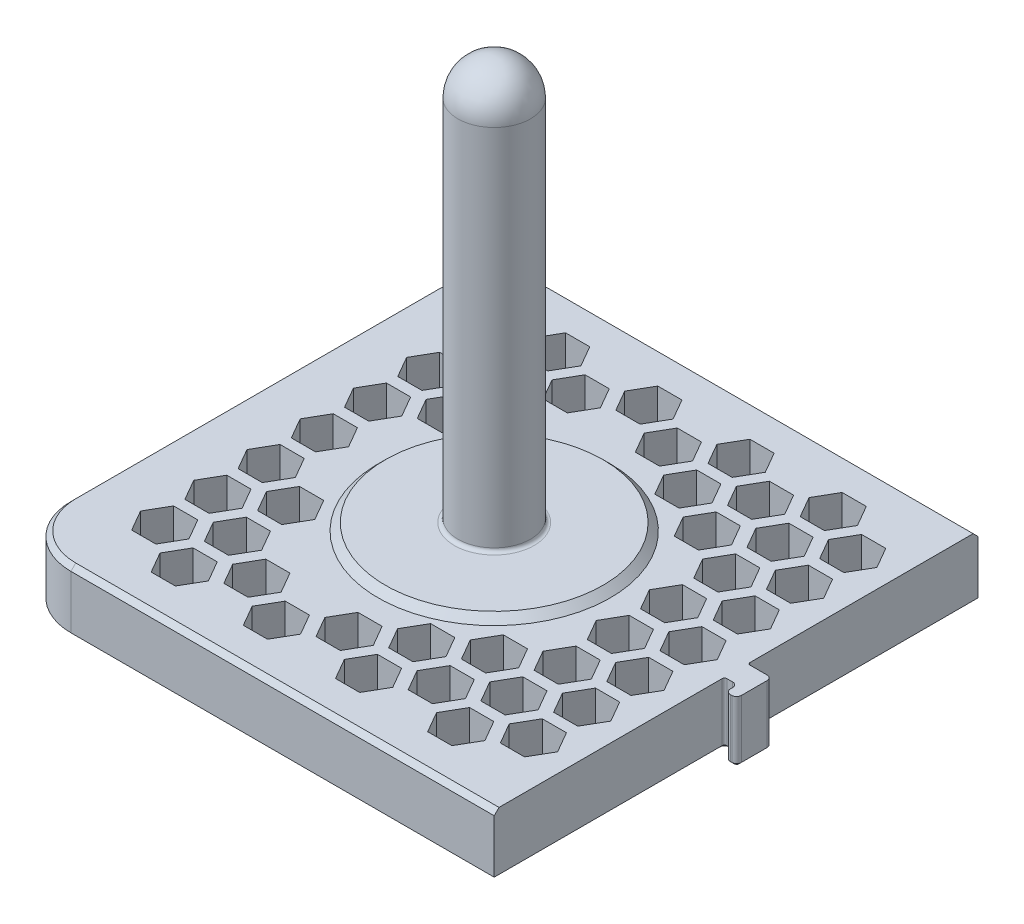
from build123d import *

# Parameters (mm, degrees)
SKETCH1_W           = 200
SKETCH1_H           = 200
BOSS_EXTRUDE1_DEPTH = 25
SKETCH2_R           = 15
BOSS_EXTRUDE2_DEPTH = 170
BOSS_EXTRUDE3_DEPTH = 25
FILLET1_R           = 1
FILLET2_R           = 25
FILLET3_R           = 15
SKETCH5_R           = 45
BOSS_EXTRUDE4_DEPTH = 3
CHAMFER1_SIZE       = 3
FILLET4_R           = 1.5
CHAMFER2_SIZE       = 2
FILL_PATTERN1_DEPTH = 25
CHAMFER3_SIZE       = 1


# Read off the part's stored shape, not the designer's step: Fill Pattern1
with BuildPart() as part:
    # Sketch1 → Boss-Extrude1 (new body)
    with BuildSketch(Plane(origin=(0, 0, 0), x_dir=(1, 0, 0), z_dir=(0, 1, 0))):
        Rectangle(SKETCH1_W, SKETCH1_H)
    extrude(amount=BOSS_EXTRUDE1_DEPTH)

    # Sketch2 → Boss-Extrude2 (add)
    with BuildSketch(Plane(origin=(0, 25, 0), x_dir=(1, 0, 0), z_dir=(0, 1, 0))):
        with Locations(Location((0, 0, 0), (0, 0, 270))):
            Circle(SKETCH2_R)
    extrude(amount=BOSS_EXTRUDE2_DEPTH)

    # Sketch4 → Boss-Extrude3 (add)
    with BuildSketch(Plane(origin=(0, 0, 0), x_dir=(1, 0, 0), z_dir=(0, 1, 0))):
        with BuildLine():
            Line((100, 4.8), (108, 4.8))
            ThreePointArc((108, 4.8), (109.414213562, 4.214213562), (110, 2.8))
            Line((110, 2.8), (110, -7.8))
            ThreePointArc((110, -7.8), (109.414213562, -9.214213562), (108, -9.8))
            Line((108, -9.8), (107.4, -9.8))
            ThreePointArc((107.4, -9.8), (105.985786438, -9.214213562), (105.4, -7.8))
            Line((105.4, -7.8), (105.4, -6.8))
            ThreePointArc((105.4, -6.8), (104.814213562, -5.385786438), (103.4, -4.8))
            Line((103.4, -4.8), (100, -4.8))
            Line((100, -4.8), (100, 4.8))
        make_face()
    extrude(amount=BOSS_EXTRUDE3_DEPTH)

    # Fillet1
    fillet1_edges = [part.edges().sort_by_distance(p)[0] for p in [
        (100, 12.5, -4.8),
        (100, 12.5, 4.8),
    ]]
    fillet(fillet1_edges, radius=FILLET1_R)

    # Fillet2
    fillet2_edges = [part.edges().sort_by_distance(p)[0] for p in [
        (-100, 12.5, -100),
        (-100, 12.5, 100),
    ]]
    fillet(fillet2_edges, radius=FILLET2_R)

    # Fillet3
    fillet3_edges = [part.edges().sort_by_distance(p)[0] for p in [
        (0, 195, -15),
    ]]
    fillet(fillet3_edges, radius=FILLET3_R)

    # Sketch5 → Boss-Extrude4 (add)
    with BuildSketch(Plane(origin=(0, 25, 0), x_dir=(1, 0, 0), z_dir=(0, 1, 0))):
        with Locations(Location((0, 0, 0), (0, 0, 270))):
            Circle(SKETCH5_R)
    extrude(amount=BOSS_EXTRUDE4_DEPTH)

    # Chamfer1
    chamfer1_edges = [part.edges().sort_by_distance(p)[0] for p in [
        (0, 25, -45),
    ]]
    chamfer(chamfer1_edges, length=CHAMFER1_SIZE - 0.0001)  # a hair under: the kernel refuses the full size

    # Fillet4
    fillet4_edges = [part.edges().sort_by_distance(p)[0] for p in [
        (0, 28, -15),
    ]]
    fillet(fillet4_edges, radius=FILLET4_R)

    # Chamfer2
    chamfer2_edges = [part.edges().sort_by_distance(p)[0] for p in [
        (12.5, 25, -100),
        (-100, 25, 0),
        (12.5, 25, 100),
        (-92.67766953, 25, 92.67766953),
        (-92.67766953, 25, -92.67766953),
    ]]
    chamfer(chamfer2_edges, length=CHAMFER2_SIZE)

    # Fill Pattern1 outline → Fill Pattern1 (cut)
    with BuildSketch(Plane(origin=(0, 0, 0), x_dir=(1, 0, 0), z_dir=(0, 1, 0))):
        Polygon((-61.15767665, 77), (-56.15767665, 68.339745962), (-46.15767665, 68.339745962), (-41.15767665, 77), (-46.15767665, 85.660254038), (-56.15767665, 85.660254038), align=None)
        Polygon((15.052558883, -55), (20.052558883, -63.660254038), (30.052558883, -63.660254038), (35.052558883, -55), (30.052558883, -46.339745962), (20.052558883, -46.339745962), align=None)
        Polygon((58.15767665, 68.339745962), (68.15767665, 68.339745962), (73.15767665, 77), (68.15767665, 85.660254038), (58.15767665, 85.660254038), (53.15767665, 77), align=None)
        Polygon((20.052558883, 68.339745962), (30.052558883, 68.339745962), (35.052558883, 77), (30.052558883, 85.660254038), (20.052558883, 85.660254038), (15.052558883, 77), align=None)
        Polygon((-18.052558883, 68.339745962), (-8.052558883, 68.339745962), (-3.052558883, 77), (-8.052558883, 85.660254038), (-18.052558883, 85.660254038), (-23.052558883, 77), align=None)
        Polygon((-65.210235533, 35.339745962), (-60.210235533, 44), (-65.210235533, 52.660254038), (-75.210235533, 52.660254038), (-80.210235533, 44), (-75.210235533, 35.339745962), align=None)
        Polygon((-61.15767665, -77), (-56.15767665, -85.660254038), (-46.15767665, -85.660254038), (-41.15767665, -77), (-46.15767665, -68.339745962), (-56.15767665, -68.339745962), align=None)
        Polygon((-80.210235533, -44), (-75.210235533, -52.660254038), (-65.210235533, -52.660254038), (-60.210235533, -44), (-65.210235533, -35.339745962), (-75.210235533, -35.339745962), align=None)
        Polygon((20.052558883, -85.660254038), (30.052558883, -85.660254038), (35.052558883, -77), (30.052558883, -68.339745962), (20.052558883, -68.339745962), (15.052558883, -77), align=None)
        Polygon((-18.052558883, -85.660254038), (-8.052558883, -85.660254038), (-3.052558883, -77), (-8.052558883, -68.339745962), (-18.052558883, -68.339745962), (-23.052558883, -77), align=None)
        Polygon((58.15767665, -85.660254038), (68.15767665, -85.660254038), (73.15767665, -77), (68.15767665, -68.339745962), (58.15767665, -68.339745962), (53.15767665, -77), align=None)
        Polygon((30.052558883, 46.339745962), (35.052558883, 55), (30.052558883, 63.660254038), (20.052558883, 63.660254038), (15.052558883, 55), (20.052558883, 46.339745962), align=None)
        Polygon((-56.15767665, -63.660254038), (-46.15767665, -63.660254038), (-41.15767665, -55), (-46.15767665, -46.339745962), (-56.15767665, -46.339745962), (-61.15767665, -55), align=None)
        Polygon((58.15767665, -63.660254038), (68.15767665, -63.660254038), (73.15767665, -55), (68.15767665, -46.339745962), (58.15767665, -46.339745962), (53.15767665, -55), align=None)
        Polygon((87.210235533, 35.339745962), (92.210235533, 44), (87.210235533, 52.660254038), (77.210235533, 52.660254038), (72.210235533, 44), (77.210235533, 35.339745962), align=None)
        Polygon((68.15767665, 2.339745962), (73.15767665, 11), (68.15767665, 19.660254038), (58.15767665, 19.660254038), (53.15767665, 11), (58.15767665, 2.339745962), align=None)
        Polygon((-4, -66), (1, -74.660254038), (11, -74.660254038), (16, -66), (11, -57.339745962), (1, -57.339745962), align=None)
        Polygon((-80.210235533, 66), (-75.210235533, 57.339745962), (-65.210235533, 57.339745962), (-60.210235533, 66), (-65.210235533, 74.660254038), (-75.210235533, 74.660254038), align=None)
        Polygon((-61.15767665, 33), (-56.15767665, 24.339745962), (-46.15767665, 24.339745962), (-41.15767665, 33), (-46.15767665, 41.660254038), (-56.15767665, 41.660254038), align=None)
        Polygon((-75.210235533, -74.660254038), (-65.210235533, -74.660254038), (-60.210235533, -66), (-65.210235533, -57.339745962), (-75.210235533, -57.339745962), (-80.210235533, -66), align=None)
        Polygon((77.210235533, -74.660254038), (87.210235533, -74.660254038), (92.210235533, -66), (87.210235533, -57.339745962), (77.210235533, -57.339745962), (72.210235533, -66), align=None)
        Polygon((-37.105117767, -74.660254038), (-27.105117767, -74.660254038), (-22.105117767, -66), (-27.105117767, -57.339745962), (-37.105117767, -57.339745962), (-42.105117767, -66), align=None)
        Polygon((39.105117767, -74.660254038), (49.105117767, -74.660254038), (54.105117767, -66), (49.105117767, -57.339745962), (39.105117767, -57.339745962), (34.105117767, -66), align=None)
        Polygon((68.15767665, 24.339745962), (73.15767665, 33), (68.15767665, 41.660254038), (58.15767665, 41.660254038), (53.15767665, 33), (58.15767665, 24.339745962), align=None)
        Polygon((87.210235533, 57.339745962), (92.210235533, 66), (87.210235533, 74.660254038), (77.210235533, 74.660254038), (72.210235533, 66), (77.210235533, 57.339745962), align=None)
        Polygon((-61.15767665, 55), (-56.15767665, 46.339745962), (-46.15767665, 46.339745962), (-41.15767665, 55), (-46.15767665, 63.660254038), (-56.15767665, 63.660254038), align=None)
        Polygon((87.210235533, 13.339745962), (92.210235533, 22), (87.210235533, 30.660254038), (77.210235533, 30.660254038), (72.210235533, 22), (77.210235533, 13.339745962), align=None)
        Polygon((49.105117767, -52.660254038), (54.105117767, -44), (49.105117767, -35.339745962), (39.105117767, -35.339745962), (34.105117767, -44), (39.105117767, -52.660254038), align=None)
        Polygon((68.15767665, -19.660254038), (73.15767665, -11), (68.15767665, -2.339745962), (58.15767665, -2.339745962), (53.15767665, -11), (58.15767665, -19.660254038), align=None)
        Polygon((11, 57.339745962), (16, 66), (11, 74.660254038), (1, 74.660254038), (-4, 66), (1, 57.339745962), align=None)
        Polygon((-46.15767665, -41.660254038), (-41.15767665, -33), (-46.15767665, -24.339745962), (-56.15767665, -24.339745962), (-61.15767665, -33), (-56.15767665, -41.660254038), align=None)
        Polygon((77.210235533, -52.660254038), (87.210235533, -52.660254038), (92.210235533, -44), (87.210235533, -35.339745962), (77.210235533, -35.339745962), (72.210235533, -44), align=None)
        Polygon((-80.210235533, -22), (-75.210235533, -30.660254038), (-65.210235533, -30.660254038), (-60.210235533, -22), (-65.210235533, -13.339745962), (-75.210235533, -13.339745962), align=None)
        Polygon((77.210235533, -30.660254038), (87.210235533, -30.660254038), (92.210235533, -22), (87.210235533, -13.339745962), (77.210235533, -13.339745962), (72.210235533, -22), align=None)
        Polygon((-80.210235533, 0), (-75.210235533, -8.660254038), (-65.210235533, -8.660254038), (-60.210235533, 0), (-65.210235533, 8.660254038), (-75.210235533, 8.660254038), align=None)
        Polygon((77.210235533, -8.660254038), (87.210235533, -8.660254038), (92.210235533, 0), (87.210235533, 8.660254038), (77.210235533, 8.660254038), (72.210235533, 0), align=None)
        Polygon((-27.105117767, 57.339745962), (-22.105117767, 66), (-27.105117767, 74.660254038), (-37.105117767, 74.660254038), (-42.105117767, 66), (-37.105117767, 57.339745962), align=None)
        Polygon((-80.210235533, 22), (-75.210235533, 13.339745962), (-65.210235533, 13.339745962), (-60.210235533, 22), (-65.210235533, 30.660254038), (-75.210235533, 30.660254038), align=None)
        Polygon((68.15767665, 46.339745962), (73.15767665, 55), (68.15767665, 63.660254038), (58.15767665, 63.660254038), (53.15767665, 55), (58.15767665, 46.339745962), align=None)
        Polygon((53.15767665, -33), (58.15767665, -41.660254038), (68.15767665, -41.660254038), (73.15767665, -33), (68.15767665, -24.339745962), (58.15767665, -24.339745962), align=None)
        Polygon((39.105117767, 57.339745962), (49.105117767, 57.339745962), (54.105117767, 66), (49.105117767, 74.660254038), (39.105117767, 74.660254038), (34.105117767, 66), align=None)
        Polygon((34.105117767, 44), (39.105117767, 35.339745962), (49.105117767, 35.339745962), (54.105117767, 44), (49.105117767, 52.660254038), (39.105117767, 52.660254038), align=None)
    extrude(amount=FILL_PATTERN1_DEPTH, mode=Mode.SUBTRACT)

    # Chamfer3
    chamfer3_edges = [part.edges().sort_by_distance(p)[0] for p in [
        (104.814213562, 0, 5.385786438),
        (105.4, 0, 7.3),
        (105.985786438, 0, 9.214213562),
        (107.7, 0, 9.8),
        (109.414213562, 0, 9.214213562),
        (110, 0, 2.5),
        (109.414213562, 0, -4.214213562),
        (104.5, 0, -4.8),
        (100, 0, -52.9),
        (102.2, 0, 4.8),
        (100.292893219, 0, -5.092893219),
        (100.292893219, 0, 5.092893219),
        (12.5, 0, -100),
        (100, 0, 52.9),
        (-100, 0, 0),
        (12.5, 0, 100),
        (-92.67766953, 0, 92.67766953),
        (-92.67766953, 0, -92.67766953),
    ]]
    chamfer(chamfer3_edges, length=CHAMFER3_SIZE)


solid = part.part
